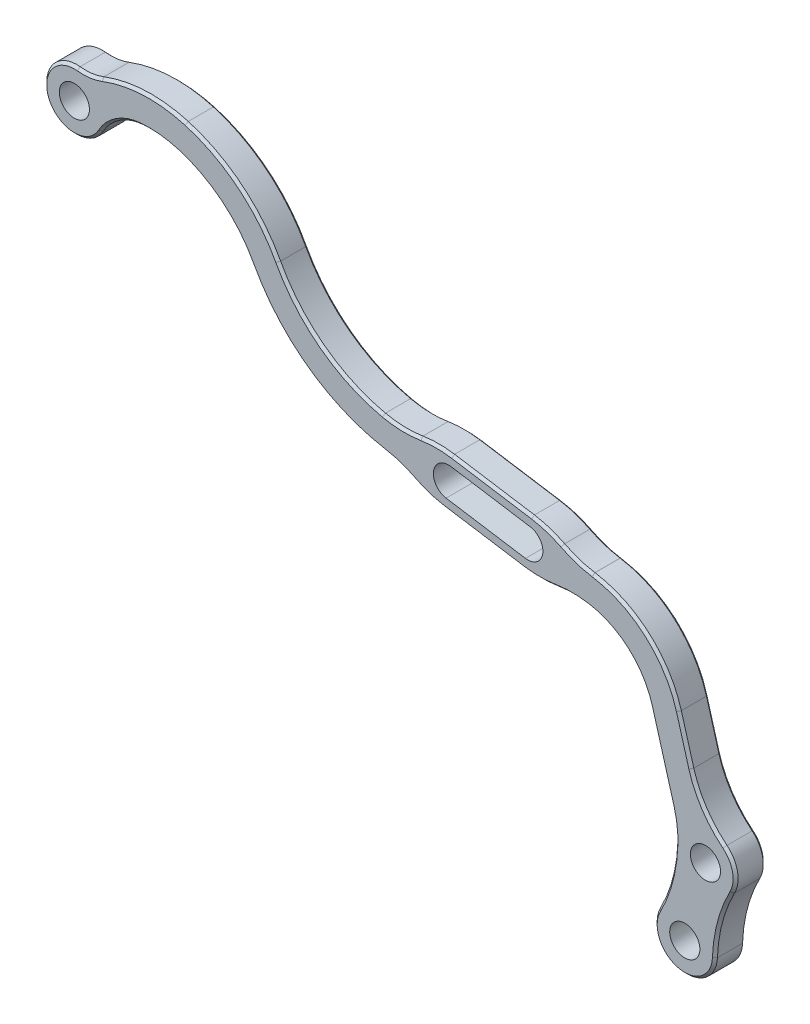
from build123d import *
from OCP.BRepFilletAPI import BRepFilletAPI_MakeFillet

# Parameters (mm, degrees)
EXTRUDE_THIN1_DEPTH     = 3
SKETCH1_6_R             = 3
BOSS_EXTRUDE2_DEPTH     = 3
FILLET1_R               = 10
FILLET2_R               = 10
FILLET3_R1              = 10
FILLET3_R2              = 5
CHAMFER1_SIZE           = 0.25
CUT_EXTRUDE1_DEPTH      = 90.36389433
F_3_0_MM_DOWEL_HOLES1_D = 3


with BuildPart() as part:
    # Sketch1 → Extrude-Thin1 (new body)
    with BuildSketch(Plane.XY):
        with BuildLine():
            ThreePointArc((13.956778483, 1.844761957), (18.364214045, 3.961300509), (23.249537827, 3.764233943))
            ThreePointArc((23.249537827, 3.764233943), (27.544341573, 1.513827454), (30.636293504, -2.221075738))
            ThreePointArc((30.636293504, -2.221075738), (36.280115015, -8.611383188), (44.176022564, -11.827498007))
            Line((44.176022564, -11.827498007), (64.112853909, -14.973721748))
            ThreePointArc((64.112853909, -14.973721748), (67.995089498, -16.803438115), (70.284091708, -20.433876661))
            Line((70.284091708, -20.433876661), (73.760858733, -32.587064718))
            Line((73.760858733, -32.587064718), (76.645152845, -31.761929896))
            Line((76.645152845, -31.761929896), (73.168385821, -19.60874184))
            ThreePointArc((73.168385821, -19.60874184), (69.983011914, -14.556626047), (64.580495529, -12.010394005))
            Line((64.580495529, -12.010394005), (44.643664184, -8.864170263))
            ThreePointArc((44.643664184, -8.864170263), (38.016065461, -6.164655567), (33.278803277, -0.80081446))
            ThreePointArc((33.278803277, -0.80081446), (29.432995007, 3.844704587), (24.091064686, 6.64378817))
            ThreePointArc((24.091064686, 6.64378817), (17.757357703, 6.899280322), (12.043221517, 4.155238043))
            Line((12.043221517, 4.155238043), (13.956778483, 1.844761957))
        make_face()
    extrude(amount=EXTRUDE_THIN1_DEPTH)

    # Sketch1<6> → Boss-Extrude2 (add)
    with BuildSketch(Plane.XY):
        with BuildLine():
            ThreePointArc((78.472958706, -32.673622319), (75.046124973, -34.175890794), (72.819900547, -31.168578904))
            ThreePointArc((72.819900547, -31.168578904), (72.324756821, -34.48620054), (71.104744395, -37.610836569))
            ThreePointArc((71.104744395, -37.610836569), (74.47911855, -36.0951074), (76.759757859, -39.007584043))
            ThreePointArc((76.759757859, -39.007584043), (76.759268993, -39.061740839), (76.757802553, -39.115879984))
            ThreePointArc((76.757802553, -39.115879984), (77.252946279, -35.798258348), (78.472958706, -32.673622319))
        make_face()
        with BuildLine():
            ThreePointArc((78.817945242, -31.276874845), (77.878853444, -29.096815814), (75.649506987, -28.281607152))
            Line((75.649506987, -28.281607152), (76.645152845, -31.761929896))
            Line((76.645152845, -31.761929896), (75.203005789, -32.174497307))
            Line((75.203005789, -32.174497307), (73.760858733, -32.587064718))
            Line((73.760858733, -32.587064718), (73.053014062, -30.112763351))
            ThreePointArc((73.053014062, -30.112763351), (72.888498306, -30.63008226), (72.819900547, -31.168578904))
            ThreePointArc((72.819900547, -31.168578904), (75.046124973, -34.175890794), (78.472958706, -32.673622319))
            ThreePointArc((78.472958706, -32.673622319), (78.730421885, -31.996235537), (78.817945242, -31.276874845))
        make_face()
        with Locations((73.759757859, -39.007584043)):
            Circle(SKETCH1_6_R)
        with Locations((13, 3)):
            Circle(SKETCH1_6_R)
        Polygon((46.29255307, -8.112005426), (62.855890569, -10.725859392), (62.07648787, -15.664738964), (45.51315037, -13.050884998), align=None)
    extrude(amount=BOSS_EXTRUDE2_DEPTH)

    # Fillet1
    # the kernel refuses this fillet: 10 mm, written as the material it takes off along each edge
    with BuildSketch(Plane(origin=(45.51315037, -13.050884998, -10.897247359), x_dir=(0.9877759145103069, -0.1558805398801499, 0), z_dir=(0, 0, 1)), Plane(origin=(62.855890569, -10.725859392, -10.897247359), x_dir=(-0.9877759145103069, 0.15588053988014952, 0), z_dir=(0, 0, 1))) as fillet1_piece_1:
        with BuildLine():
            CenterArc((4.358898944, 10), FILLET1_R, 244.158067237, 25.841932763)
            Line((0, 1), (-0.087177979, 0.82))
            ThreePointArc((-0.087177979, 0.82), (-0.2, 0.5), (-0.2, 0))
            Line((-0.2, 0), (0, -0.2))
            Line((0, -0.2), (4.358898944, -0.2))
            Line((4.358898944, -0.2), (4.358898944, 0))
        make_face()
    extrude(amount=24.794494718, mode=Mode.SUBTRACT)
    with BuildSketch(Plane(origin=(62.07648787, -15.664738964, -10.897247359), x_dir=(0.1558805398801516, 0.9877759145103067, 0), z_dir=(0, 0, 1)), Plane(origin=(46.29255307, -8.112005426, -10.897247359), x_dir=(-0.1558805398801516, -0.9877759145103067, 0), z_dir=(0, 0, 1))) as fillet1_piece_2:
        with BuildLine():
            CenterArc((10, 4.358898944), FILLET1_R, 180, 25.841932763)
            Line((0, 4.358898944), (-0.2, 4.358898944))
            Line((-0.2, 4.358898944), (-0.2, 0))
            Line((-0.2, 0), (0, -0.2))
            ThreePointArc((0, -0.2), (0.5, -0.2), (0.82, -0.087177979))
            Line((0.82, -0.087177979), (1, 0))
        make_face()
    extrude(amount=24.794494718, mode=Mode.SUBTRACT)

    # Fillet2
    fillet2_edges = [part.edges().sort_by_distance(p)[0] for p in [
        (62.23236841, -14.67696305, 1.5),
        (62.70001003, -11.713635306, 1.5),
        (45.66903091, -12.063109084, 1.5),
        (46.13667253, -9.09978134, 1.5),
    ]]
    fillet(fillet2_edges, radius=FILLET2_R)

    # Fillet3: one fillet with a radius per group of edges: ONE call of the kernel's fillet builder (fillet() takes one radius for all edges)
    fillet3_edges_1 = [part.edges().sort_by_distance(p)[0] for p in [
        (73.053014062, -30.112763351, 1.5),
        (75.649506987, -28.281607152, 1.5),
    ]]
    fillet3_edges_2 = [part.edges().sort_by_distance(p)[0] for p in [
        (14.342872483, 5.682665371, 1.5),
        (15.99591873, 3.156431979, 1.5),
    ]]
    fillet3 = BRepFilletAPI_MakeFillet(part.part.solid().wrapped)
    for e in fillet3_edges_1:
        fillet3.Add(FILLET3_R1, e.wrapped)
    for e in fillet3_edges_2:
        fillet3.Add(FILLET3_R2, e.wrapped)
    add(Compound.cast(fillet3.Shape()), mode=Mode.REPLACE)

    # Chamfer1
    chamfer1_edges = [part.edges().sort_by_distance(p)[0] for p in [
        (54.57422182, -9.418932409, 0),
        (60.092477637, -10.417114134, 0),
        (48.27462413, -13.358997517, 0),
        (54.57422182, -9.418932409, 3),
        (49.025073316, -8.669242301, 3),
        (59.352291729, -15.107486729, 3),
        (29.432995007, 3.844704587, 0),
        (48.27462413, -13.358997517, 3),
        (64.571774389, -12.009017725, 0),
        (36.178802299, -8.53899299, 0),
        (36.178802299, -8.53899299, 3),
        (37.633792223, -5.884652293, 0),
        (37.633792223, -5.884652293, 3),
        (21.456361373, 4.116360797, 3),
        (69.983011914, -14.556626047, 0),
        (49.025073316, -8.669242301, 0),
        (59.352291729, -15.107486729, 0),
        (60.092477637, -10.417114134, 3),
        (45.406180886, -12.157630236, 0),
        (45.406180886, -12.157630236, 3),
        (45.57735687, -8.918557885, 0),
        (45.57735687, -8.918557885, 3),
        (62.513992379, -14.848753903, 0),
        (67.995089498, -16.803438115, 0),
        (62.513992379, -14.848753903, 3),
        (63.02085079, -11.636919182, 0),
        (63.02085079, -11.636919182, 3),
        (64.104132769, -14.972345468, 0),
        (27.544341573, 1.513827454, 0),
        (21.456361373, 4.116360797, 0),
        (10.338658069, 1.615348734, 3),
        (19.856644471, 7.158769061, 0),
        (10.338658069, 1.615348734, 0),
        (73.788452871, -21.776212775, 0),
        (73.788452871, -21.776212775, 3),
        (71.36386404, -24.208267097, 0),
        (71.36386404, -24.208267097, 3),
        (72.820223354, -31.159983943, 0),
        (72.820223354, -31.159983943, 3),
        (17.30302071, 3.35546819, 0),
        (27.544341573, 1.513827454, 3),
        (17.30302071, 3.35546819, 3),
        (14.523458256, 5.993511964, 0),
        (14.523458256, 5.993511964, 3),
        (75.675797588, -26.700228887, 3),
        (75.675797588, -26.700228887, 0),
        (72.759314108, -29.551891496, 3),
        (72.759314108, -29.551891496, 0),
        (64.104132769, -14.972345468, 3),
        (67.995089498, -16.803438115, 3),
        (78.757105023, -30.675759401, 0),
        (77.252946279, -35.798258348, 0),
        (72.324756821, -34.48620054, 0),
        (72.987937591, -41.906599992, 0),
        (72.324756821, -34.48620054, 3),
        (72.987937591, -41.906599992, 3),
        (77.252946279, -35.798258348, 3),
        (78.757105023, -30.675759401, 3),
        (69.983011914, -14.556626047, 3),
        (64.571774389, -12.009017725, 3),
        (19.856644471, 7.158769061, 3),
        (29.432995007, 3.844704587, 3),
        (53.79481912, -14.357811981, 0),
        (53.79481912, -14.357811981, 3),
    ]]
    chamfer(chamfer1_edges, length=CHAMFER1_SIZE)

    # Sketch2 → Cut-Extrude1 (cut, through all)
    with BuildSketch(Plane.XY.offset(3)):
        with BuildLine():
            Line((50.467237622, -9.783186164), (58.369444938, -11.030230483))
            ThreePointArc((58.369444938, -11.030230483), (59.617288, -12.745715164), (57.901803318, -13.993558226))
            Line((57.901803318, -13.993558226), (49.999596002, -12.746513907))
            ThreePointArc((49.999596002, -12.746513907), (48.75175294, -11.031029225), (50.467237622, -9.783186164))
        make_face()
    extrude(amount=-CUT_EXTRUDE1_DEPTH, mode=Mode.SUBTRACT)

    # Ø3.0 mm Dowel Holes1 (through all)
    with Locations(Plane.XY.offset(3)):
        with Locations((13, 3), (75.817945242, -31.276874845), (73.759757859, -39.007584043)):
            Hole(F_3_0_MM_DOWEL_HOLES1_D / 2)


solid = part.part
